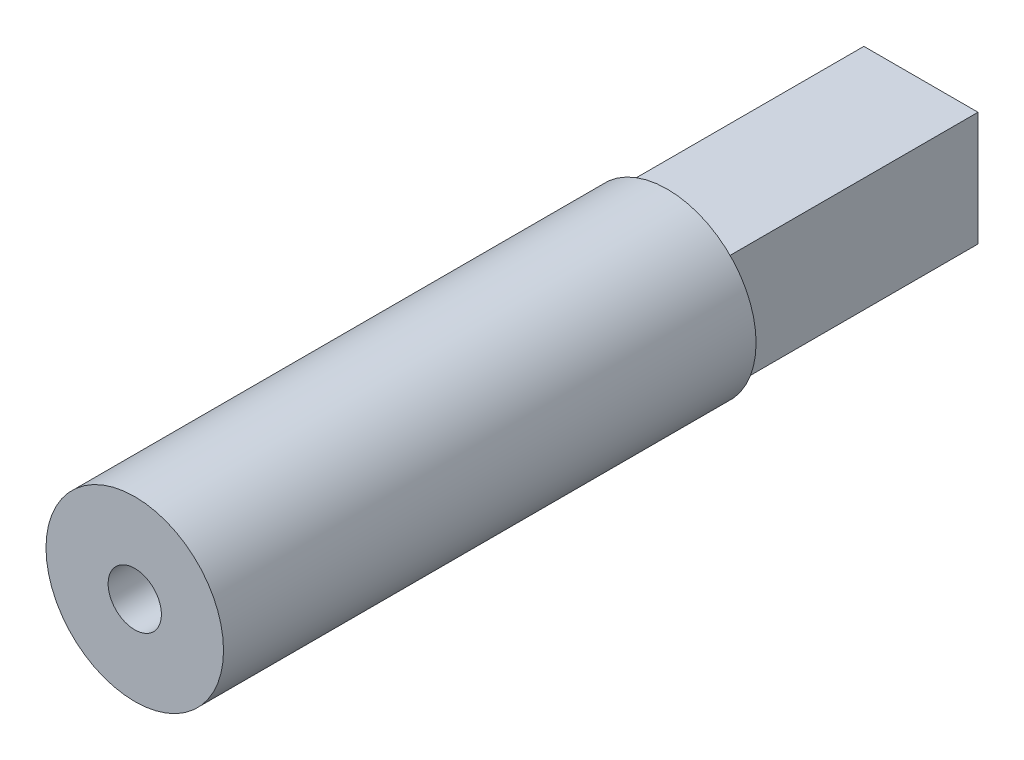
from build123d import *

# Parameters (mm, degrees)
SKETCH2_R           = 3.5
BOSS_EXTRUDE1_DEPTH = 31
SKETCH4_R           = 3.5
SKETCH4_W           = 4.5
SKETCH4_H           = 4.5
CUT_EXTRUDE1_DEPTH  = 10
SKETCH7_R           = 1.05
CUT_EXTRUDE2_DEPTH  = 6


with BuildPart() as part:
    # Sketch2 → Boss-Extrude1 (new body)
    with BuildSketch(Plane.XY):
        Circle(SKETCH2_R)
    extrude(amount=BOSS_EXTRUDE1_DEPTH)

    # Sketch4 → Cut-Extrude1 (cut)
    with BuildSketch(Plane(origin=(0, 0, 0), x_dir=(-1, 0, 0), z_dir=(0, 0, -1))):
        Circle(SKETCH4_R)
        Rectangle(SKETCH4_W, SKETCH4_H, mode=Mode.SUBTRACT)
    extrude(amount=-CUT_EXTRUDE1_DEPTH, mode=Mode.SUBTRACT)

    # Sketch7 → Cut-Extrude2 (cut)
    with BuildSketch(Plane.XY.offset(31)):
        Circle(SKETCH7_R)
    extrude(amount=-CUT_EXTRUDE2_DEPTH, mode=Mode.SUBTRACT)


solid = part.part
